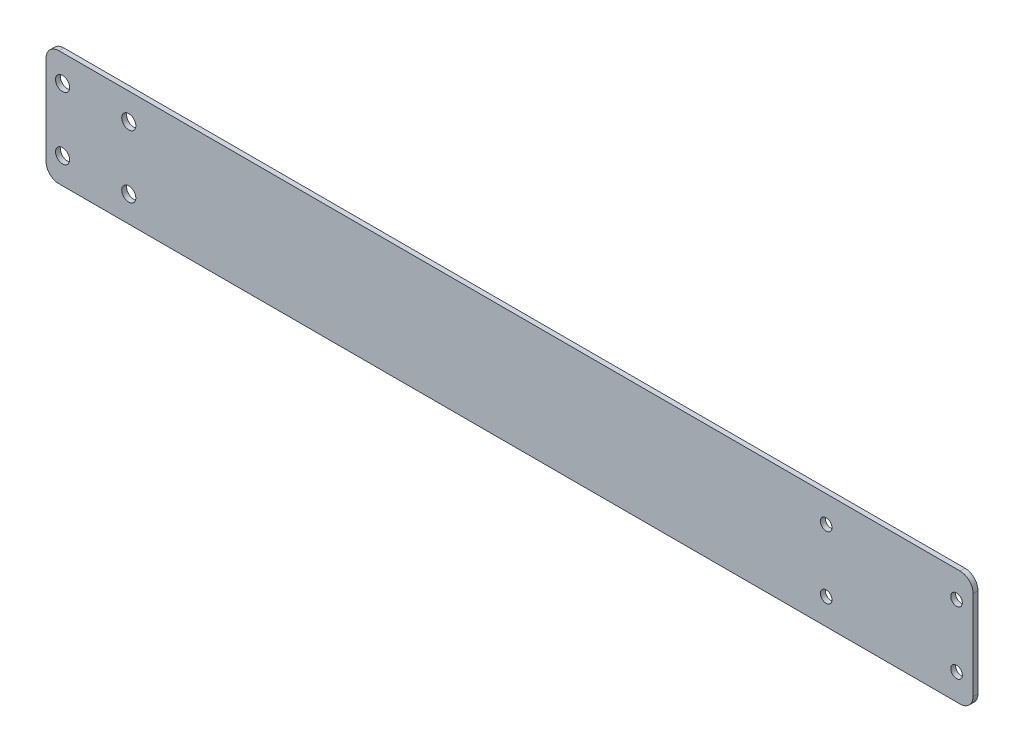
from build123d import *

# Parameters (mm, degrees)
SKETCH1_W          = 355.6
SKETCH1_H          = 44.196
SKETCH1_R          = 2.2225
SKETCH1_R_2        = 2.7051
BASE_FLANGE1_DEPTH = 1.8796
FILLET1_R          = 5


# Sheet-metal steps are written as plain solids
with BuildPart() as part:
    # Sketch1 → Base-Flange1 (new body)
    with BuildSketch(Plane.XY):
        with Locations((177.8, 22.098)):
            Rectangle(SKETCH1_W, SKETCH1_H)
        with Locations((299.25, 10)):
            Circle(SKETCH1_R, mode=Mode.SUBTRACT)
        with Locations((349.25, 10)):
            Circle(SKETCH1_R, mode=Mode.SUBTRACT)
        with Locations((349.25, 34)):
            Circle(SKETCH1_R, mode=Mode.SUBTRACT)
        with Locations((299.25, 34)):
            Circle(SKETCH1_R, mode=Mode.SUBTRACT)
        with Locations((6.35, 34)):
            Circle(SKETCH1_R_2, mode=Mode.SUBTRACT)
        with Locations((31.75, 34)):
            Circle(SKETCH1_R_2, mode=Mode.SUBTRACT)
        with Locations((6.35, 10)):
            Circle(SKETCH1_R_2, mode=Mode.SUBTRACT)
        with Locations((31.75, 10)):
            Circle(SKETCH1_R_2, mode=Mode.SUBTRACT)
    extrude(amount=-BASE_FLANGE1_DEPTH)

    # Fillet1
    fillet1_edges = [part.edges().sort_by_distance(p)[0] for p in [
        (0, 44.196, -0.9398),
        (355.6, 44.196, -0.9398),
        (355.6, 0, -0.9398),
        (0, 0, -0.9398),
    ]]
    fillet(fillet1_edges, radius=FILLET1_R)


solid = part.part
